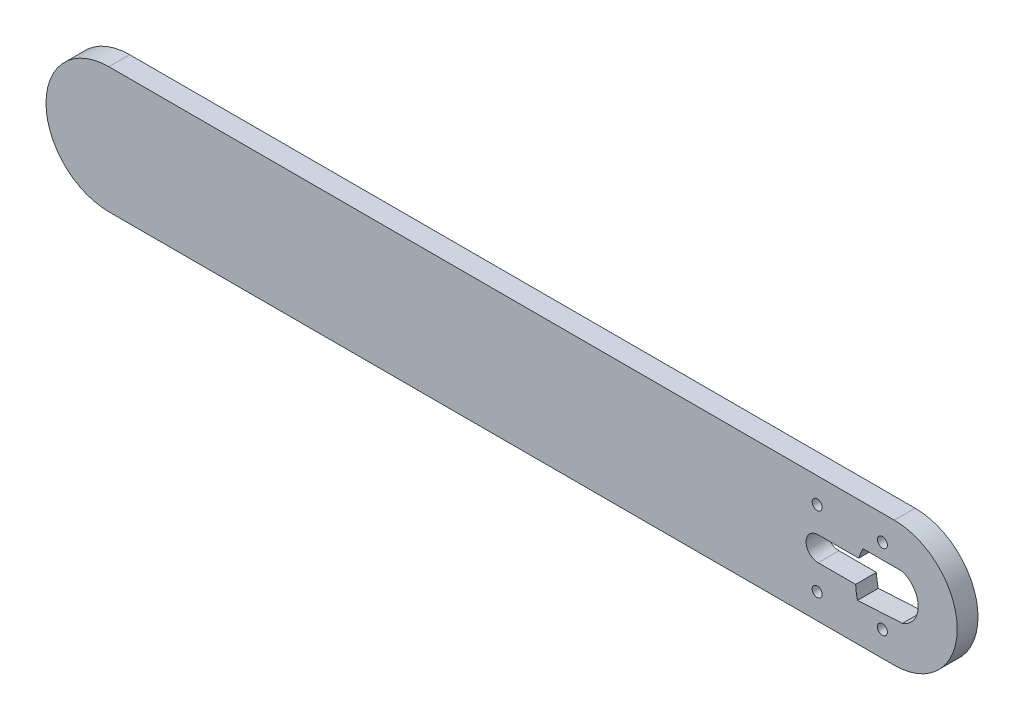
from build123d import *

# Parameters (mm, degrees)
BOSS_EXTRUDE1_DEPTH = 6.62
CUT_EXTRUDE1_REACH  = 325.859
CUT_EXTRUDE2_REACH  = 325.859
SKETCH3_R           = 1.6
SKETCH4_R           = 2.75
CUT_EXTRUDE3_DEPTH  = 3.2


with BuildPart() as part:
    # Sketch1 → Boss-Extrude1 (new body)
    with BuildSketch(Plane.XY):
        with BuildLine():
            Line((-53.14999664, -20.367507575), (-303.15, -20.367507575))
            ThreePointArc((-303.15, -20.367507575), (-323.15, -0.367507575), (-303.15, 19.632492425))
            Line((-303.15, 19.632492425), (-53.14999664, 19.632492425))
            ThreePointArc((-53.14999664, 19.632492425), (-33.15, -0.367507575), (-53.14999664, -20.367507575))
        make_face()
    extrude(amount=BOSS_EXTRUDE1_DEPTH)

    # Sketch2 → Cut-Extrude1 (cut, up to next)
    with BuildSketch(Plane(origin=(0, 0, 0), x_dir=(-1, 0, 0), z_dir=(0, 0, -1)), mode=Mode.PRIVATE) as cut_extrude1_sk1:
        with BuildLine():
            Line((50.572912403, 6.782222269), (63.15, 6.782222269))
            ThreePointArc((63.15, 6.782222269), (63.887643146, 5.159584754), (64.491324549, 3.482492425))
            Line((64.491324549, 3.482492425), (77.39999664, 3.482492425))
            ThreePointArc((77.39999664, 3.482492425), (81.24999664, -0.367507575), (77.39999664, -4.217507575))
            Line((77.39999664, -4.217507575), (65.47720817, -4.217507575))
            ThreePointArc((65.47720817, -4.217507575), (65.274788166, -6.285668574), (64.877878283, -8.325454425))
            Line((64.877878283, -8.325454425), (50.572912403, -7.517237419))
            ThreePointArc((50.572912403, -7.517237419), (45.54999664, -0.367507575), (50.572912403, 6.782222269))
        make_face()
    cut_extrude1_tool1 = extrude(cut_extrude1_sk1.sketch, amount=-CUT_EXTRUDE1_REACH, mode=Mode.PRIVATE) & part.part
    add(cut_extrude1_tool1.solids().sort_by_distance((-61.166461, -0.552448, 0))[0], mode=Mode.SUBTRACT)

    # Sketch3 → Cut-Extrude2 (cut, up to next)
    with BuildSketch(Plane(origin=(0, 0, 0), x_dir=(-1, 0, 0), z_dir=(0, 0, -1)), mode=Mode.PRIVATE) as cut_extrude2_sk1:
        with Locations((77.715530374, -12.367507575)):
            Circle(SKETCH3_R)
    cut_extrude2_tool1 = extrude(cut_extrude2_sk1.sketch, amount=-CUT_EXTRUDE2_REACH, mode=Mode.PRIVATE) & part.part
    # Sketch3 → Cut-Extrude2 (cut, up to next)
    with BuildSketch(Plane(origin=(0, 0, 0), x_dir=(-1, 0, 0), z_dir=(0, 0, -1)), mode=Mode.PRIVATE) as cut_extrude2_sk2:
        with Locations((77.715530374, 11.632492425)):
            Circle(SKETCH3_R)
    cut_extrude2_tool2 = extrude(cut_extrude2_sk2.sketch, amount=-CUT_EXTRUDE2_REACH, mode=Mode.PRIVATE) & part.part
    # Sketch3 → Cut-Extrude2 (cut, up to next)
    with BuildSketch(Plane(origin=(0, 0, 0), x_dir=(-1, 0, 0), z_dir=(0, 0, -1)), mode=Mode.PRIVATE) as cut_extrude2_sk3:
        with Locations((56.965530374, 11.632492425)):
            Circle(SKETCH3_R)
    cut_extrude2_tool3 = extrude(cut_extrude2_sk3.sketch, amount=-CUT_EXTRUDE2_REACH, mode=Mode.PRIVATE) & part.part
    # Sketch3 → Cut-Extrude2 (cut, up to next)
    with BuildSketch(Plane(origin=(0, 0, 0), x_dir=(-1, 0, 0), z_dir=(0, 0, -1)), mode=Mode.PRIVATE) as cut_extrude2_sk4:
        with Locations((56.965530374, -12.367507575)):
            Circle(SKETCH3_R)
    cut_extrude2_tool4 = extrude(cut_extrude2_sk4.sketch, amount=-CUT_EXTRUDE2_REACH, mode=Mode.PRIVATE) & part.part
    add(cut_extrude2_tool1.solids().sort_by_distance((-77.71553, -12.367508, 0))[0], mode=Mode.SUBTRACT)
    add(cut_extrude2_tool2.solids().sort_by_distance((-77.71553, 11.632492, 0))[0], mode=Mode.SUBTRACT)
    add(cut_extrude2_tool3.solids().sort_by_distance((-56.96553, 11.632492, 0))[0], mode=Mode.SUBTRACT)
    add(cut_extrude2_tool4.solids().sort_by_distance((-56.96553, -12.367508, 0))[0], mode=Mode.SUBTRACT)

    # Sketch4 → Cut-Extrude3 (cut)
    with BuildSketch(Plane(origin=(0, 0, 0), x_dir=(-1, 0, 0), z_dir=(0, 0, -1))):
        with Locations((56.965530374, 11.632492425)):
            Circle(SKETCH4_R)
        with Locations((77.715530374, 11.632492425)):
            Circle(SKETCH4_R)
        with Locations((77.715530374, -12.367507575)):
            Circle(SKETCH4_R)
        with Locations((56.965530374, -12.367507575)):
            Circle(SKETCH4_R)
    extrude(amount=-CUT_EXTRUDE3_DEPTH, mode=Mode.SUBTRACT)


solid = part.part
